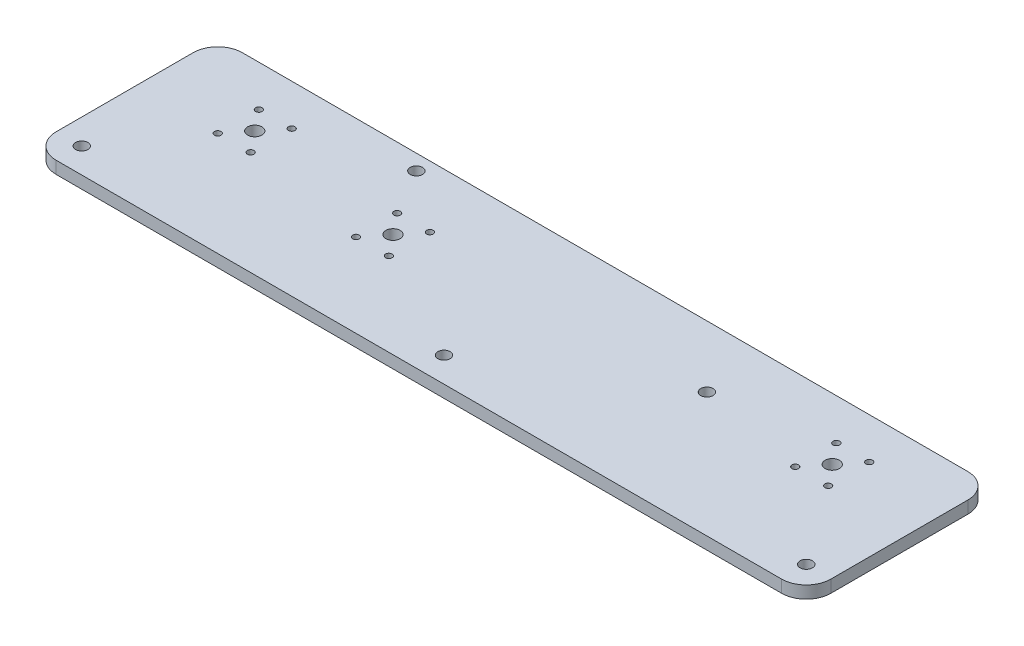
from build123d import *

# Parameters (mm, degrees)
ESBO_O1_R                = 3.5
ESBO_O1_R_2              = 3
ESBO_O1_R_3              = 1.6
RESSALTO_EXTRUS_O1_DEPTH = 6


with BuildPart() as part:
    # Esboço1 → Ressalto-extrusão1 (new body)
    with BuildSketch(Plane(origin=(0, 0, 0), x_dir=(1, 0, 0), z_dir=(0, 1, 0))):
        with BuildLine():
            Line((188.965018959, -38.648697641), (188.965018959, 28))
            ThreePointArc((188.965018959, 28), (185.450300333, 36.485281374), (176.965018959, 40))
            Line((176.965018959, 40), (-176.090826953, 40))
            ThreePointArc((-176.090826953, 40), (-184.576108327, 36.485281374), (-188.090826953, 28))
            Line((-188.090826953, 28), (-188.090826953, -38.648697641))
            ThreePointArc((-188.090826953, -38.648697641), (-184.576108327, -47.133979015), (-176.090826953, -50.648697641))
            Line((-176.090826953, -50.648697641), (176.965018959, -50.648697641))
            ThreePointArc((176.965018959, -50.648697641), (185.450300333, -47.133979015), (188.965018959, -38.648697641))
        make_face()
        with Locations((-62.803346953, 0)):
            Circle(ESBO_O1_R, mode=Mode.SUBTRACT)
        with Locations((176.748138959, -38.431817641)):
            Circle(ESBO_O1_R_2, mode=Mode.SUBTRACT)
        with Locations((0.437096003, -38.431817641)):
            Circle(ESBO_O1_R_2, mode=Mode.SUBTRACT)
        with Locations((79.965018959, 10)):
            Circle(ESBO_O1_R_2, mode=Mode.SUBTRACT)
        with Locations((-140.090826953, 10)):
            Circle(ESBO_O1_R, mode=Mode.SUBTRACT)
        with Locations((-148.090826953, 0)):
            Circle(ESBO_O1_R_3, mode=Mode.SUBTRACT)
        with Locations((-132.090826953, 0)):
            Circle(ESBO_O1_R_3, mode=Mode.SUBTRACT)
        with Locations((-132.090826953, 20)):
            Circle(ESBO_O1_R_3, mode=Mode.SUBTRACT)
        with Locations((-148.090826953, 20)):
            Circle(ESBO_O1_R_3, mode=Mode.SUBTRACT)
        with Locations((-70.803346953, -10)):
            Circle(ESBO_O1_R_3, mode=Mode.SUBTRACT)
        with Locations((-70.803346953, 10)):
            Circle(ESBO_O1_R_3, mode=Mode.SUBTRACT)
        with Locations((-54.803346953, 10)):
            Circle(ESBO_O1_R_3, mode=Mode.SUBTRACT)
        with Locations((-54.803346953, -10)):
            Circle(ESBO_O1_R_3, mode=Mode.SUBTRACT)
        with Locations((-83.930342624, 32.5)):
            Circle(ESBO_O1_R_2, mode=Mode.SUBTRACT)
        with Locations((-175.873946953, -38.431817641)):
            Circle(ESBO_O1_R_2, mode=Mode.SUBTRACT)
        with Locations((140.965018959, 10)):
            Circle(ESBO_O1_R, mode=Mode.SUBTRACT)
        with Locations((148.965018959, 0)):
            Circle(ESBO_O1_R_3, mode=Mode.SUBTRACT)
        with Locations((148.965018959, 20)):
            Circle(ESBO_O1_R_3, mode=Mode.SUBTRACT)
        with Locations((132.965018959, 0)):
            Circle(ESBO_O1_R_3, mode=Mode.SUBTRACT)
        with Locations((132.965018959, 20)):
            Circle(ESBO_O1_R_3, mode=Mode.SUBTRACT)
    extrude(amount=-RESSALTO_EXTRUS_O1_DEPTH)


solid = part.part
